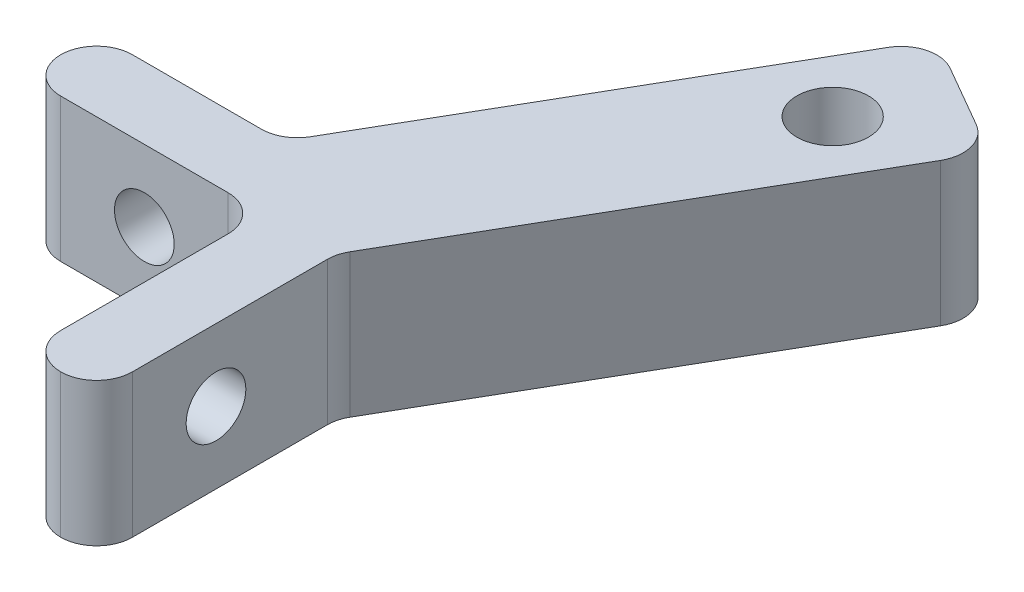
from build123d import *

# Parameters (mm, degrees)
BOSS_EXTRUDE1_DEPTH      = 6
BOSS_EXTRUDE1_DEPTH_BACK = 6
SKETCH1_R                = 3
SKETCH2_R                = 2.5
CUT_EXTRUDE1_DEPTH       = 44.824009589
SKETCH3_R                = 2.5
CUT_EXTRUDE2_DEPTH       = 52.241882852
FILLET1_R                = 3


with BuildPart() as part:
    # Sketch1 → Boss-Extrude1 (new, two sides: drawn at the far end of the back side and taken through both)
    with BuildSketch(Plane(origin=(0, 0, 0), x_dir=(1, 0, 0), z_dir=(0, 1, 0)).offset(-BOSS_EXTRUDE1_DEPTH_BACK)):
        Polygon((0, 0), (-15.536622966, 0), (-15.536622966, -6), (4.463377034, -6), (4.463377034, -26), (10.463377034, -26), (10.463377034, -5.876899358), (30.463377034, 28.764116793), (20.071072189, 34.764116793), (2.632022894, 4.55879738), align=None)
        with Locations(Location((21.267224611, 24.835913563, 0), (0, 0, 270))):
            Circle(SKETCH1_R, mode=Mode.SUBTRACT)
    extrude(amount=BOSS_EXTRUDE1_DEPTH + BOSS_EXTRUDE1_DEPTH_BACK)

    # Sketch2 → Cut-Extrude1 (cut, through all)
    with BuildSketch(Plane.ZY.offset(-4.463377034)):
        with Locations((16, 0)):
            Circle(SKETCH2_R)
    extrude(amount=-CUT_EXTRUDE1_DEPTH, mode=Mode.SUBTRACT)

    # Sketch3 → Cut-Extrude2 (cut, through all)
    with BuildSketch(Plane.XY.offset(6)):
        with Locations((-5.536622966, 0)):
            Circle(SKETCH3_R)
    extrude(amount=-CUT_EXTRUDE2_DEPTH, mode=Mode.SUBTRACT)

    # Fillet1
    fillet1_edges = [part.edges().sort_by_distance(p)[0] for p in [
        (10.463377034, 0, 26),
        (4.463377034, 0, 26),
        (-15.536622966, 0, 6),
        (-15.536622966, 0, 0),
        (4.463377034, 0, 6),
        (10.463377034, 0, 5.876899358),
        (30.463377034, 0, -28.764116793),
        (20.071072189, 0, -34.764116793),
        (0, 0, 0),
    ]]
    fillet(fillet1_edges, radius=FILLET1_R - 0.0001)  # a hair under: the kernel refuses the full size


solid = part.part
